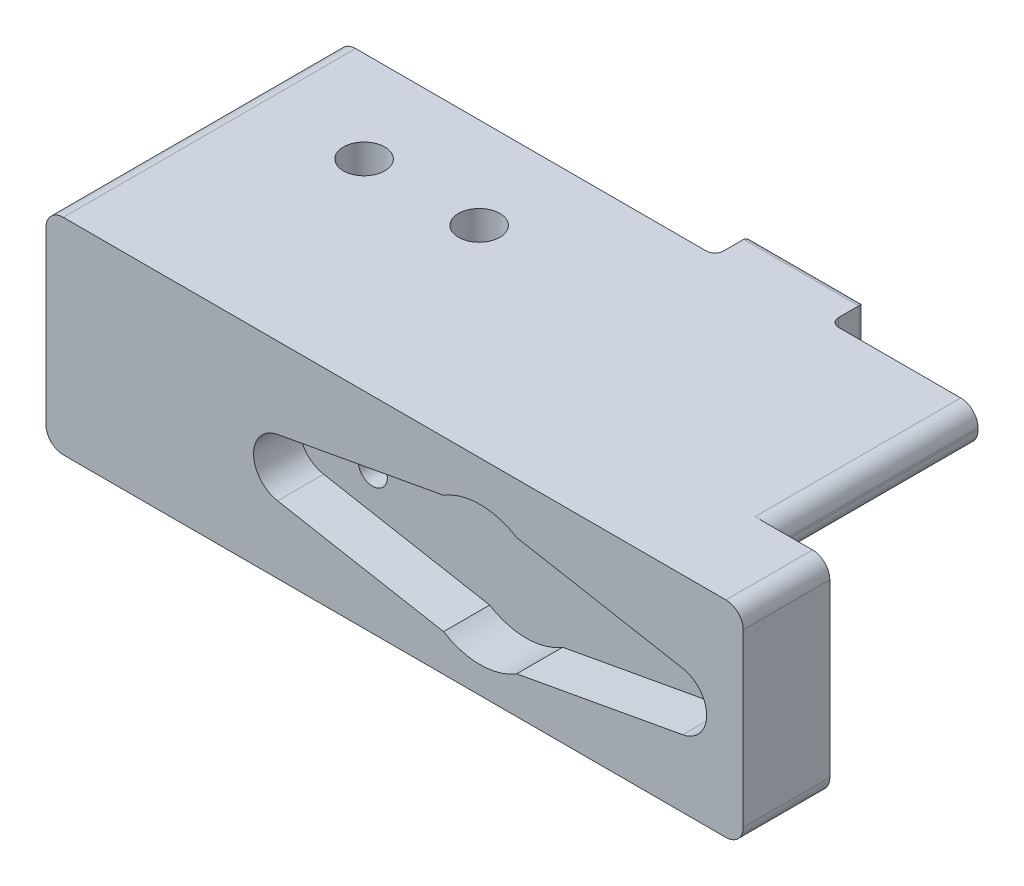
from build123d import *

# Parameters (mm, degrees)
SKETCH1_W                       = 75.438
SKETCH1_H                       = 12.7
BOSS_EXTRUDE1_DEPTH             = 6.35
CUT_EXTRUDE1_DEPTH              = 4
BOSS_EXTRUDE2_REACH             = 40.773
SKETCH3_W                       = 75.438
SKETCH3_H                       = 19.05
SKETCH3_W_2                     = 69.088
SKETCH3_H_2                     = 12.7
BOSS_EXTRUDE2_DIRECTION_2_REACH = 40.773
SKETCH4_W                       = 75.438
SKETCH4_H                       = 25.4
BOSS_EXTRUDE4_DEPTH             = 3.175
SKETCH7_W                       = 14.859
SKETCH7_H                       = 15.875
CUT_EXTRUDE3_DEPTH              = 47.460828512
SKETCH8_W                       = 3.175
SKETCH8_H                       = 15.875
CUT_EXTRUDE4_DEPTH              = 65.214043371
BOSS_EXTRUDE5_DEPTH             = 3.175
SKETCH11_W                      = 57.404
SKETCH11_H                      = 12.7
CUT_EXTRUDE5_DEPTH              = 2
SKETCH12_R                      = 1.27
CUT_EXTRUDE6_DEPTH              = 45.400547136
SKETCH10_R                      = 1.8
CUT_EXTRUDE7_DEPTH              = 45.123864983
SKETCH13_W                      = 17.875
SKETCH13_H                      = 3.175
CUT_EXTRUDE8_DEPTH              = 5
SKETCH14_W                      = 10
SKETCH14_H                      = 14.655071008
BOSS_EXTRUDE6_DEPTH             = 3
SKETCH15_R                      = 2.1
CUT_EXTRUDE9_DEPTH              = 2
BOSS_EXTRUDE7_DEPTH             = 2
FILLET3_R                       = 0.5
FILLET4_R                       = 0.75
FILLET5_R                       = 0.75
FILLET6_R                       = 0.75
FILLET2_R                       = 1.5


with BuildPart() as part:
    # Sketch1 → Boss-Extrude1 (new body)
    with BuildSketch(Plane.XY):
        Rectangle(SKETCH1_W, SKETCH1_H)
    extrude(amount=BOSS_EXTRUDE1_DEPTH)

    # Sketch2 → Cut-Extrude1 (cut)
    with BuildSketch(Plane.XY.offset(6.35)):
        with BuildLine():
            Line((3.175, 5.129369479), (17.6006647, 2.498793645))
            ThreePointArc((17.6006647, 2.498793645), (19.685, 0), (17.6006647, -2.498793645))
            Line((17.6006647, -2.498793645), (3.175, -5.129369479))
            ThreePointArc((3.175, -5.129369479), (0, -6.0325), (-3.175, -5.129369479))
            Line((-3.175, -5.129369479), (-17.6006647, -2.498793645))
            ThreePointArc((-17.6006647, -2.498793645), (-19.685, 0), (-17.6006647, 2.498793645))
            Line((-17.6006647, 2.498793645), (-3.175, 5.129369479))
            ThreePointArc((-3.175, 5.129369479), (0, 6.0325), (3.175, 5.129369479))
        make_face()
    extrude(amount=-CUT_EXTRUDE1_DEPTH, mode=Mode.SUBTRACT)

    # Boss-Extrude2: up to this face of the body (flat: up to its plane)
    boss_extrude2_end = Plane(part.part.faces().sort_by_distance((0, 6.35, 3.175))[0])
    # Sketch3 → Boss-Extrude2 (add, up to the picked face)
    with BuildSketch(Plane(origin=(0, 0, 0), x_dir=(1, 0, 0), z_dir=(0, 1, 0)), mode=Mode.PRIVATE) as boss_extrude2_sk1:
        with Locations((0, 9.525)):
            Rectangle(SKETCH3_W, SKETCH3_H)
        with Locations((0, 9.525)):
            Rectangle(SKETCH3_W_2, SKETCH3_H_2, mode=Mode.SUBTRACT)
    boss_extrude2_tool1 = split(extrude(boss_extrude2_sk1.sketch, amount=BOSS_EXTRUDE2_REACH, mode=Mode.PRIVATE), bisect_by=boss_extrude2_end, keep=Keep.BOTH, mode=Mode.PRIVATE)
    add(boss_extrude2_tool1.solids().sort_by(Axis((0, 0, -0.778061), (0, 1, 0)))[0])

    # Boss-Extrude2 direction 2: up to this face of the body (flat: up to its plane)
    boss_extrude2_direction_2_end = Plane(part.part.faces().sort_by_distance((0, -6.35, 3.175))[0])
    # Sketch3 → Boss-Extrude2 direction 2 (add, up to the picked face)
    with BuildSketch(Plane(origin=(0, 0, 0), x_dir=(1, 0, 0), z_dir=(0, 1, 0)), mode=Mode.PRIVATE) as boss_extrude2_direction_2_sk1:
        with Locations((0, 9.525)):
            Rectangle(SKETCH3_W, SKETCH3_H)
        with Locations((0, 9.525)):
            Rectangle(SKETCH3_W_2, SKETCH3_H_2, mode=Mode.SUBTRACT)
    boss_extrude2_direction_2_tool1 = split(extrude(boss_extrude2_direction_2_sk1.sketch, amount=-BOSS_EXTRUDE2_DIRECTION_2_REACH, mode=Mode.PRIVATE), bisect_by=boss_extrude2_direction_2_end, keep=Keep.BOTH, mode=Mode.PRIVATE)
    add(boss_extrude2_direction_2_tool1.solids().sort_by(Axis((0, 0, -0.778061), (0, -1, 0)))[0])

    # Sketch4 → Boss-Extrude4 (add)
    with BuildSketch(Plane(origin=(0, 6.35, 0), x_dir=(1, 0, 0), z_dir=(0, 1, 0))):
        with Locations((0, 6.35)):
            Rectangle(SKETCH4_W, SKETCH4_H)
    extrude(amount=BOSS_EXTRUDE4_DEPTH)

    # Sketch7 → Cut-Extrude3 (cut, through all)
    with BuildSketch(Plane.XY.offset(6.35)):
        with Locations((30.2895, 1.5875)):
            Rectangle(SKETCH7_W, SKETCH7_H)
    extrude(amount=-CUT_EXTRUDE3_DEPTH, mode=Mode.SUBTRACT)

    # Sketch8 → Cut-Extrude4 (cut, through all)
    with BuildSketch(Plane(origin=(22.86, 0, 0), x_dir=(0, 0, -1), z_dir=(1, 0, 0))):
        with Locations((17.4625, 1.5875)):
            Rectangle(SKETCH8_W, SKETCH8_H)
    extrude(amount=-CUT_EXTRUDE4_DEPTH, mode=Mode.SUBTRACT)

    # Sketch9 → Boss-Extrude5 (add)
    with BuildSketch(Plane(origin=(0, 0, -15.875), x_dir=(-1, 0, 0), z_dir=(0, 0, -1))):
        Polygon((34.544, 6.35), (34.544, -6.35), (37.719, -6.35), (37.719, 9.525), (-22.86, 9.525), (-22.86, 6.35), align=None)
    extrude(amount=BOSS_EXTRUDE5_DEPTH)

    # Sketch11 → Cut-Extrude5 (cut)
    with BuildSketch(Plane(origin=(0, 0, -3.175), x_dir=(-1, 0, 0), z_dir=(0, 0, -1))):
        with Locations((5.842, 0)):
            Rectangle(SKETCH11_W, SKETCH11_H)
    extrude(amount=-CUT_EXTRUDE5_DEPTH, mode=Mode.SUBTRACT)

    # Sketch12 → Cut-Extrude6 (cut, through all)
    with BuildSketch(Plane.XY.offset(2.35)):
        with Locations((13.335, 0)):
            Circle(SKETCH12_R)
        with Locations(Location((-13.335, 0, 0), (0, 0, 180))):
            Circle(SKETCH12_R)
    extrude(amount=-CUT_EXTRUDE6_DEPTH, mode=Mode.SUBTRACT)

    # Sketch10 → Cut-Extrude7 (cut, through all)
    with BuildSketch(Plane.XZ.offset(-6.35)):
        with Locations(Location((-27.544, -11.1125, 0), (0, 0, 270))):
            Circle(SKETCH10_R)
        with Locations(Location((-17.544, -11.1125, 0), (0, 0, 270))):
            Circle(SKETCH10_R)
    extrude(amount=-CUT_EXTRUDE7_DEPTH, mode=Mode.SUBTRACT)

    # Sketch13 → Cut-Extrude8 (cut)
    with BuildSketch(Plane(origin=(22.86, 0, 0), x_dir=(0, 0, -1), z_dir=(1, 0, 0))):
        with Locations((10.1125, 7.9375)):
            Rectangle(SKETCH13_W, SKETCH13_H)
    extrude(amount=-CUT_EXTRUDE8_DEPTH, mode=Mode.SUBTRACT)

    # Sketch14 → Boss-Extrude6 (add)
    with BuildSketch(Plane(origin=(0, 0, -19.05), x_dir=(-1, 0, 0), z_dir=(0, 0, -1))):
        with Locations((0, 2.197464496)):
            Rectangle(SKETCH14_W, SKETCH14_H)
    extrude(amount=BOSS_EXTRUDE6_DEPTH)

    # Sketch15 → Cut-Extrude9 (cut)
    with BuildSketch(Plane(origin=(0, 0, -22.05), x_dir=(-1, 0, 0), z_dir=(0, 0, -1))):
        Circle(SKETCH15_R)
    extrude(amount=-CUT_EXTRUDE9_DEPTH, mode=Mode.SUBTRACT)

    # Sketch16 → Boss-Extrude7 (add)
    with BuildSketch(Plane.XZ.offset(6.35)):
        Polygon((-34.544, -19.05), (-34.544, -1.175), (22.86, -1.175), (22.86, 6.35), (-37.719, 6.35), (-37.719, -19.05), align=None)
    extrude(amount=BOSS_EXTRUDE7_DEPTH)

    # Fillet3
    fillet3_edges = [part.edges().sort_by_distance(p)[0] for p in [
        (-5, -5.130071008, -20.55),
        (5, -5.130071008, -20.55),
        (-5, 2.197464496, -22.05),
        (0, 9.525, -22.05),
        (5, 2.197464496, -22.05),
        (0, -5.130071008, -22.05),
    ]]
    fillet(fillet3_edges, radius=FILLET3_R)

    # Fillet4
    # the kernel refuses this fillet: 0.75 mm, written as the material it adds along each edge
    with BuildSketch(Plane(origin=(5, 9.525, -19.05), x_dir=(0, 0, -1), z_dir=(0, -1, 0))) as fillet4_piece_1:
        with BuildLine():
            CenterArc((FILLET4_R, FILLET4_R), FILLET4_R, 180, 90)
            Line((0, FILLET4_R), (0, 0))
            Line((0, 0), (FILLET4_R, 0))
        make_face()
    extrude(amount=3.175)

    # Fillet5
    # the kernel refuses this fillet: 0.75 mm, written as the material it adds along each edge
    with BuildSketch(Plane(origin=(-5, 6.35, -19.05), x_dir=(0, 0, -1), z_dir=(0, 1, 0))) as fillet5_piece_1:
        with BuildLine():
            CenterArc((FILLET5_R, FILLET5_R), FILLET5_R, 180, 90)
            Line((0, FILLET5_R), (0, 0))
            Line((0, 0), (FILLET5_R, 0))
        make_face()
    extrude(amount=3.175)

    # Fillet6
    fillet6_edges = [part.edges().sort_by_distance(p)[0] for p in [
        (0, 6.35, -19.05),
    ]]
    fillet(fillet6_edges, radius=FILLET6_R)

    # Fillet2
    fillet2_edges = [part.edges().sort_by_distance(p)[0] for p in [
        (22.86, 9.525, 2.5875),
        (17.86, 9.525, -10.1125),
        (17.86, 6.35, -10.1125),
        (-34.544, -8.35, -10.1125),
        (22.86, -8.35, 2.5875),
        (-37.719, -8.35, -6.35),
        (-34.544, 6.35, -10.1125),
        (-37.719, 9.525, -6.35),
    ]]
    fillet(fillet2_edges, radius=FILLET2_R)


solid = part.part
